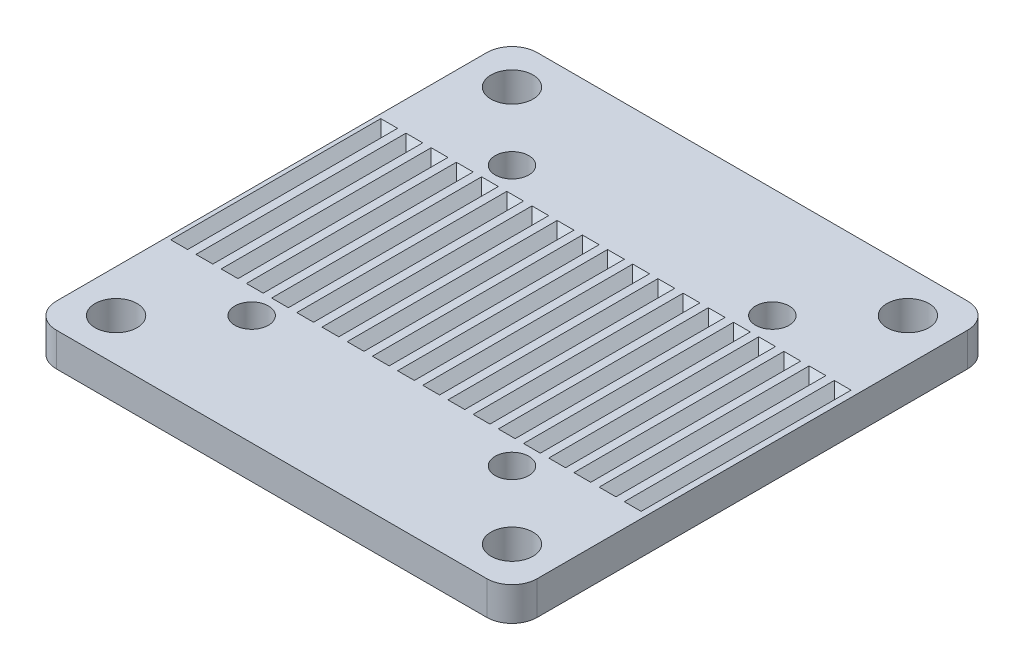
from build123d import *

# Parameters (mm, degrees)
SKETCH1_R           = 2
SKETCH1_R_2         = 2.5
BOSS_EXTRUDE1_DEPTH = 4
CUT_EXTRUDE2_DEPTH  = 23
CHAMFER2_SIZE       = 1


with BuildPart() as part:
    # Sketch1 → Boss-Extrude1 (new body)
    with BuildSketch(Plane(origin=(0, 0, 0), x_dir=(1, 0, 0), z_dir=(0, 1, 0))):
        with BuildLine():
            Line((25.625, 28.625), (-25.625, 28.625))
            ThreePointArc((-25.625, 28.625), (-27.746320344, 27.746320344), (-28.625, 25.625))
            Line((-28.625, 25.625), (-28.625, -25.625))
            ThreePointArc((-28.625, -25.625), (-27.746320344, -27.746320344), (-25.625, -28.625))
            Line((-25.625, -28.625), (25.625, -28.625))
            ThreePointArc((25.625, -28.625), (27.746320344, -27.746320344), (28.625, -25.625))
            Line((28.625, -25.625), (28.625, 25.625))
            ThreePointArc((28.625, 25.625), (27.746320344, 27.746320344), (25.625, 28.625))
        make_face()
        with Locations(Location((-15.5, 15.5, 0), (0, 0, 270))):
            Circle(SKETCH1_R, mode=Mode.SUBTRACT)
        with Locations(Location((-23.57, 23.57, 0), (0, 0, 270))):
            Circle(SKETCH1_R_2, mode=Mode.SUBTRACT)
        with Locations(Location((23.57, 23.57, 0), (0, 0, 270))):
            Circle(SKETCH1_R_2, mode=Mode.SUBTRACT)
        with Locations(Location((15.5, 15.5, 0), (0, 0, 270))):
            Circle(SKETCH1_R, mode=Mode.SUBTRACT)
        with Locations(Location((15.5, -15.5, 0), (0, 0, 270))):
            Circle(SKETCH1_R, mode=Mode.SUBTRACT)
        with Locations(Location((-15.5, -15.5, 0), (0, 0, 270))):
            Circle(SKETCH1_R, mode=Mode.SUBTRACT)
        with Locations(Location((-23.57, -23.57, 0), (0, 0, 270))):
            Circle(SKETCH1_R_2, mode=Mode.SUBTRACT)
        with Locations(Location((23.57, -23.57, 0), (0, 0, 270))):
            Circle(SKETCH1_R_2, mode=Mode.SUBTRACT)
    extrude(amount=BOSS_EXTRUDE1_DEPTH)

    # Sketch3 → Cut-Extrude2 (cut)
    with BuildSketch(Plane.XY.offset(11.5)):
        Polygon((-28.125, 4), (-27.125, 3), (-26.125, 4), align=None)
        Polygon((-25.125, 4), (-24.125, 3), (-23.125, 4), align=None)
        Polygon((-22.125, 4), (-21.125, 3), (-20.125, 4), align=None)
        Polygon((-19.125, 4), (-18.125, 3), (-17.125, 4), align=None)
        Polygon((-16.125, 4), (-15.125, 3), (-14.125, 4), align=None)
        Polygon((-13.125, 4), (-12.125, 3), (-11.125, 4), align=None)
        Polygon((-10.125, 4), (-9.125, 3), (-8.125, 4), align=None)
        Polygon((-7.125, 4), (-6.125, 3), (-5.125, 4), align=None)
        Polygon((-4.125, 4), (-3.125, 3), (-2.125, 4), align=None)
        Polygon((-1.125, 4), (-0.125, 3), (0.875, 4), align=None)
        Polygon((1.875, 4), (2.875, 3), (3.875, 4), align=None)
        Polygon((4.875, 4), (5.875, 3), (6.875, 4), align=None)
        Polygon((7.875, 4), (8.875, 3), (9.875, 4), align=None)
        Polygon((10.875, 4), (11.875, 3), (12.875, 4), align=None)
        Polygon((13.875, 4), (14.875, 3), (15.875, 4), align=None)
        Polygon((16.875, 4), (17.875, 3), (18.875, 4), align=None)
        Polygon((19.875, 4), (20.875, 3), (21.875, 4), align=None)
        Polygon((22.875, 4), (23.875, 3), (24.875, 4), align=None)
        Polygon((25.875, 4), (26.875, 3), (27.875, 4), align=None)
    extrude(amount=-CUT_EXTRUDE2_DEPTH, mode=Mode.SUBTRACT)

    # Chamfer2
    chamfer2_edges = [part.edges().sort_by_distance(p)[0] for p in [
        (26.875, 4, -11.5),
        (23.875, 4, -11.5),
        (20.875, 4, -11.5),
        (17.875, 4, -11.5),
        (14.875, 4, -11.5),
        (11.875, 4, -11.5),
        (8.875, 4, -11.5),
        (5.875, 4, -11.5),
        (2.875, 4, -11.5),
        (-0.125, 4, -11.5),
        (-3.125, 4, -11.5),
        (-6.125, 4, -11.5),
        (-9.125, 4, -11.5),
        (-12.125, 4, -11.5),
        (-15.125, 4, -11.5),
        (-18.125, 4, -11.5),
        (-21.125, 4, -11.5),
        (-24.125, 4, -11.5),
        (-27.125, 4, -11.5),
        (26.875, 4, 11.5),
        (23.875, 4, 11.5),
        (20.875, 4, 11.5),
        (17.875, 4, 11.5),
        (14.875, 4, 11.5),
        (11.875, 4, 11.5),
        (8.875, 4, 11.5),
        (5.875, 4, 11.5),
        (2.875, 4, 11.5),
        (-0.125, 4, 11.5),
        (-3.125, 4, 11.5),
        (-6.125, 4, 11.5),
        (-9.125, 4, 11.5),
        (-12.125, 4, 11.5),
        (-15.125, 4, 11.5),
        (-18.125, 4, 11.5),
        (-21.125, 4, 11.5),
        (-24.125, 4, 11.5),
        (-27.125, 4, 11.5),
    ]]
    chamfer(chamfer2_edges, length=CHAMFER2_SIZE - 0.0001)  # a hair under: the kernel refuses the full size


solid = part.part
